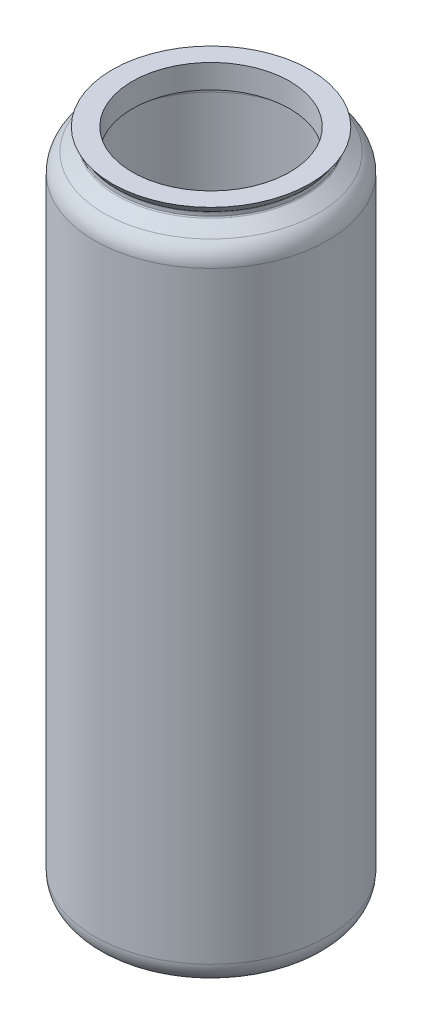
from build123d import *

# Parameters (mm, degrees)
FILLET3_R          = 7.62
FILLET7_R          = 0.508
SKETCH8_R          = 11.90625
CUT_EXTRUDE1_DEPTH = 0.396875
FILLET1_R          = 2.54
SKETCH9_R          = 6.35
CUT_EXTRUDE2_DEPTH = 0.396875
FILLET2_R          = 0.635


# Read off the part's stored shape, not the designer's step: Revolve1
with BuildPart() as part:
    # Revolve1 outline → Revolve1 (revolve)
    with BuildSketch(Plane.XY):
        with BuildLine():
            Line((0, 25.4), (0, 0))
            Line((0, 0), (31.289404712, 0))
            ThreePointArc((31.289404712, 0), (36.677558385, 2.231846327), (38.909404712, 7.62))
            Line((38.909404712, 7.62), (38.909404712, 212.725))
            Line((38.909404712, 212.725), (31.220472144, 218.159183173))
            Line((31.220472144, 218.159183173), (31.220472144, 219.746683173))
            Line((31.220472144, 219.746683173), (32.989701104, 222.25))
            Line((32.989701104, 222.25), (26.276481104, 222.25))
            Line((26.276481104, 222.25), (26.276481104, 214.3125))
            Line((26.276481104, 214.3125), (27.479404712, 214.3125))
            ThreePointArc((27.479404712, 214.3125), (31.071507161, 212.824602449), (32.559404712, 209.2325))
            Line((32.559404712, 209.2325), (32.559404712, 25.4))
            ThreePointArc((32.559404712, 25.4), (28.043634012, 20.755784366), (21.794536191, 19.05))
            ThreePointArc((21.794536191, 19.05), (19.461011381, 19.794876886), (17.251746885, 20.852860816))
            ThreePointArc((17.251746885, 20.852860816), (8.920471492, 24.244128913), (0, 25.4))
        make_face()
    revolve(axis=Axis((0, 0, 0), (0, 1, 0)))

    # Fillet3
    fillet3_edges = [part.edges().sort_by_distance(p)[0] for p in [
        (-38.909404712, 212.725, 0),
    ]]
    fillet(fillet3_edges, radius=FILLET3_R)

    # Fillet7
    fillet7_edges = [part.edges().sort_by_distance(p)[0] for p in [
        (-31.220472144, 219.746683173, 0),
        (-31.220472144, 218.159183173, 0),
    ]]
    fillet(fillet7_edges, radius=FILLET7_R)

    # Sketch8 → Cut-Extrude1 (cut)
    with BuildSketch(Plane.XZ):
        with Locations(Location((0, 0, 0), (0, 0, 270))):
            Circle(SKETCH8_R)
    extrude(amount=-CUT_EXTRUDE1_DEPTH, mode=Mode.SUBTRACT)

    # Fillet1
    # the kernel refuses this fillet: 2.54 mm, written as the material it adds along each edge
    with BuildSketch(Plane(origin=(0, 0.396875, 0), x_dir=(0, 0, -1), z_dir=(-1, 0, 0))) as fillet1_piece_1:
        with BuildLine():
            CenterArc((10.542939605, 2.54), FILLET1_R, 270, 32.461744967)
            Line((10.542939605, 0), (10.542939605, -0.0508))
            Line((10.542939605, -0.0508), (11.90625, -0.0508))
            Line((11.90625, -0.0508), (11.95705, 0))
            ThreePointArc((11.95705, 0), (11.95705, 0.1984375), (11.933516208, 0.3540125))
            Line((11.933516208, 0.3540125), (11.90625, 0.396875))
        make_face()
    revolve(axis=Axis((0, 0.396875, 0), (0, -1, 0)))

    # Sketch9 → Cut-Extrude2 (cut)
    with BuildSketch(Plane.XZ.offset(-0.396875)):
        with Locations(Location((0, 0, 0), (0, 0, 270))):
            Circle(SKETCH9_R)
    extrude(amount=-CUT_EXTRUDE2_DEPTH, mode=Mode.SUBTRACT)

    # Fillet2
    # the kernel refuses this fillet: 0.635 mm, written as the material it adds along each edge
    with BuildSketch(Plane(origin=(0, 0.79375, 0), x_dir=(0, 0, -1), z_dir=(-1, 0, 0))) as fillet2_piece_1:
        with BuildLine():
            CenterArc((5.761339245, 0.635), FILLET2_R, 270, 67.975687163)
            Line((5.761339245, 0), (5.761339245, -0.0127))
            Line((5.761339245, -0.0127), (6.35, -0.0127))
            Line((6.35, -0.0127), (6.3627, 0))
            ThreePointArc((6.3627, 0), (6.3627, 0.1984375), (6.361773215, 0.3921125))
            Line((6.361773215, 0.3921125), (6.35, 0.396875))
        make_face()
    revolve(axis=Axis((0, 0.79375, 0), (0, -1, 0)))


solid = part.part
